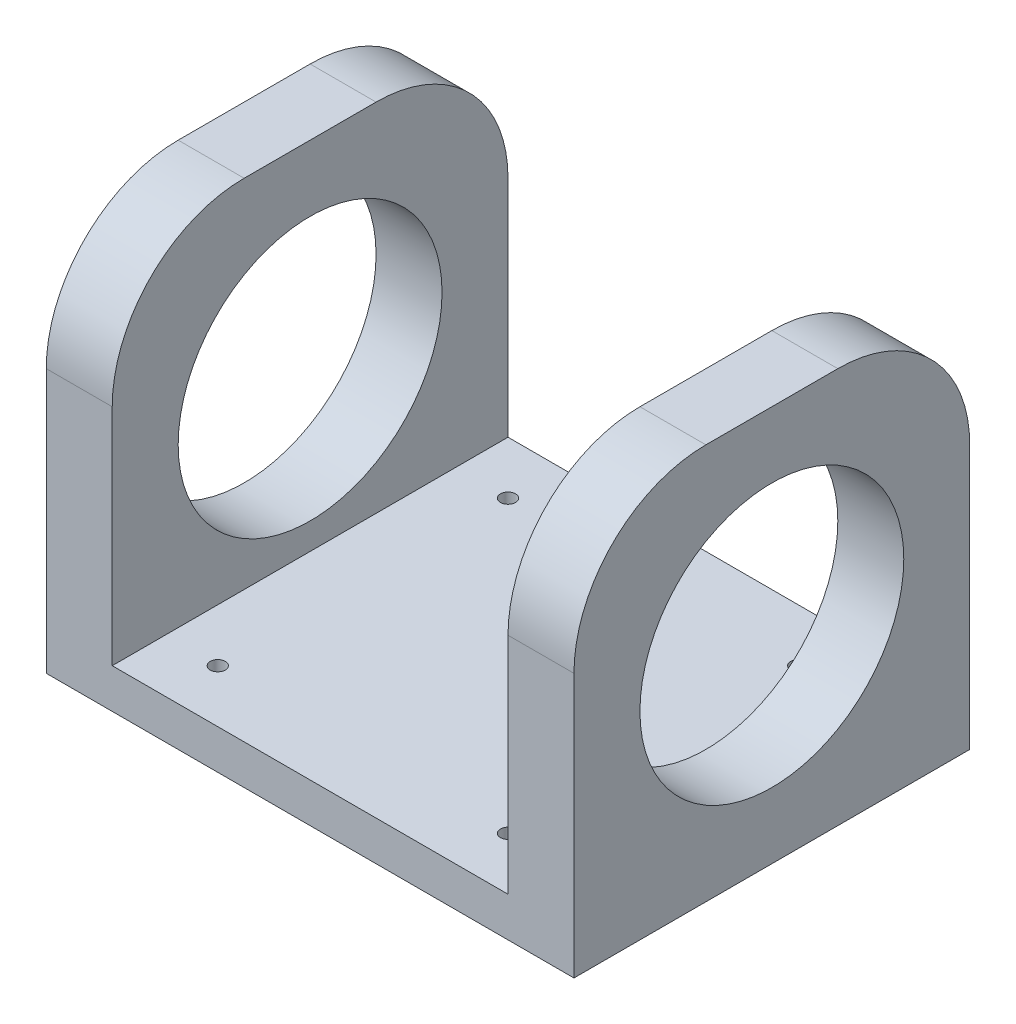
from build123d import *
from build123d.topology import SkipClean

# Parameters (mm, degrees)
SKETCH1_W           = 101.6
SKETCH1_H           = 76.2
BOSS_EXTRUDE1_DEPTH = 30.48
SKETCH2_R           = 25.4
BOSS_EXTRUDE2_DEPTH = 12.7
SKETCH3_W           = 76.2
SKETCH3_H           = 76.2
CUT_EXTRUDE1_DEPTH  = 22.86
SKETCH5_R           = 25.4
CUT_EXTRUDE3_DEPTH  = 256.032
SKETCH6_R           = 1.45
CUT_EXTRUDE4_DEPTH  = 256.032


with BuildPart() as part:
    # Sketch1 → Boss-Extrude1 (new body)
    with BuildSketch(Plane(origin=(0, 0, 0), x_dir=(1, 0, 0), z_dir=(0, 1, 0))):
        Rectangle(SKETCH1_W, SKETCH1_H)
    extrude(amount=-BOSS_EXTRUDE1_DEPTH)

    # Sketch2 → Boss-Extrude2 (add)
    with BuildSketch(Plane.ZY.offset(50.8)):
        with BuildLine():
            Line((-38.1, -30.48), (38.1, -30.48))
            Line((38.1, -30.48), (38.1, 20.32))
            ThreePointArc((38.1, 20.32), (30.660512242, 38.280512242), (12.7, 45.72))
            Line((12.7, 45.72), (-12.7, 45.72))
            ThreePointArc((-12.7, 45.72), (-30.660512242, 38.280512242), (-38.1, 20.32))
            Line((-38.1, 20.32), (-38.1, -30.48))
        make_face()
        with Locations((0, 7.62)):
            Circle(SKETCH2_R, mode=Mode.SUBTRACT)
    boss_extrude2 = extrude(amount=-BOSS_EXTRUDE2_DEPTH)

    # Mirror1: Boss-Extrude2 across plane
    add(boss_extrude2.mirror(Plane(origin=(0, 0, 0), x_dir=(0, 0, 1), z_dir=(1, 0, 0))))

    # Sketch3 → Cut-Extrude1 (cut)
    with BuildSketch(Plane(origin=(0, 0, 0), x_dir=(1, 0, 0), z_dir=(0, 1, 0))):
        Rectangle(SKETCH3_W, SKETCH3_H)
    extrude(amount=-CUT_EXTRUDE1_DEPTH, mode=Mode.SUBTRACT)

    # Sketch5 → Cut-Extrude3 (cut)
    with SkipClean():  # the faces are left unmerged after this step: merging them gives an invalid solid
        with BuildSketch(Plane.ZY.offset(50.8)):
            with Locations((0, 7.62)):
                Circle(SKETCH5_R)
        extrude(amount=-CUT_EXTRUDE3_DEPTH, mode=Mode.SUBTRACT)

    # Sketch6 → Cut-Extrude4 (cut)
    with SkipClean():  # the faces are left unmerged after this step: merging them gives an invalid solid
        with BuildSketch(Plane(origin=(0, -22.86, 0), x_dir=(1, 0, 0), z_dir=(0, 1, 0))):
            with Locations((-27.94, 27.94)):
                Circle(SKETCH6_R)
            with Locations((27.94, 27.94)):
                Circle(SKETCH6_R)
            with Locations((27.94, -27.94)):
                Circle(SKETCH6_R)
            with Locations((-27.94, -27.94)):
                Circle(SKETCH6_R)
        extrude(amount=-CUT_EXTRUDE4_DEPTH, mode=Mode.SUBTRACT)


solid = part.part
